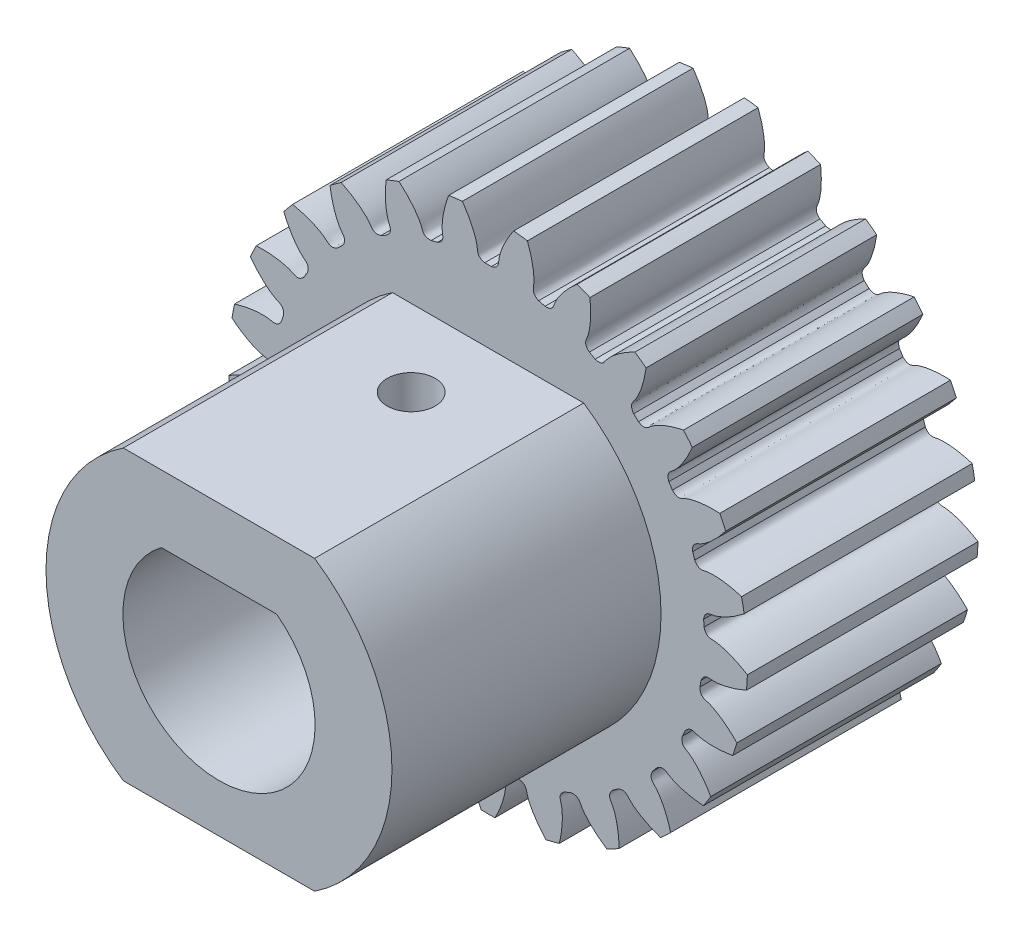
from build123d import *

# Parameters (mm, degrees)
SKETCH_1_R               = 13.5
EXTRUDE_1_DEPTH          = 12
CUT_EXTRUDE_1_DEPTH      = 23.549944568
PATTERN_CIRCULAR_1_COUNT = 25
CUT_EXTRUDE_2_DEPTH      = 23.544647042
CUT_EXTRUDE_2_DEPTH_BACK = 23.544647042
EXTRUDE_2_DEPTH          = 14
CUT_EXTRUDE_3_DEPTH      = 37.0417967
CUT_EXTRUDE_3_DEPTH_BACK = 37.0417967
SKETCH_6_R               = 1.25
EXTRUDE_3_DEPTH          = 5.8
CUT_EXTRUDE_4_DEPTH      = 33.253079125
CUT_EXTRUDE_4_DEPTH_BACK = 33.253079125
SKETCH_8_R               = 2.2
SKETCH_9_R               = 4.5
CUT_EXTRUDE_5_DEPTH      = 4


with BuildPart() as part:
    # 草图1 → 凸台-拉伸1 (new body)
    with BuildSketch(Plane.XY):
        Circle(SKETCH_1_R)
    extrude(amount=EXTRUDE_1_DEPTH)

    # 草图2 → 切除-拉伸1 (cut, through all)
    with BuildSketch(Plane.XY):
        with BuildLine():
            ThreePointArc((0.172058488, 11.248684184), (0, 11.25), (-0.172058488, 11.248684184))
            add(Edge.make_bspline(
                [(-0.172058488, 11.248684184), (-0.573339813, 11.335081162), (-0.535507636, 11.577261395), (-0.574195385, 11.818052755), (-0.579621271, 11.848108442), (-0.586576431, 11.882655524), (-0.595235519, 11.92164445), (-0.605780785, 11.965018581), (-0.618389929, 12.012716397), (-0.633239846, 12.064670833), (-0.650505245, 12.12080955), (-0.670358893, 12.181054916), (-0.692971355, 12.245324079), (-0.718510893, 12.313529018), (-0.747143311, 12.385576605), (-0.779031826, 12.461368667), (-0.814336931, 12.540802054), (-0.853216262, 12.623768711), (-0.895824463, 12.710155749), (-0.942313061, 12.799845522), (-0.992830335, 12.89271571), (-1.047521189, 12.988639399), (-1.106527031, 13.087485173), (-1.16998565, 13.189117198), (-1.238031093, 13.293395316), (-1.310793554, 13.400175144), (-1.388399253, 13.509308172), (-1.470970327, 13.62064186), (-1.558624719, 13.73401975), (-1.651476069, 13.849281567), (-1.749633611, 13.966263332), (-1.85320207, 14.084797476), (-1.962281562, 14.204712951), (-2.076967498, 14.325835353), (-2.19735049, 14.447987038), (-2.323516261, 14.570987249), (-2.455545555, 14.694652236), (-2.593514059, 14.818795387), (-2.737492286, 14.943227359), (-2.939973945, 15.111266274), (-3.09746655, 15.234093153), (-3.205271476, 15.314834171)],
                knots=[0, 0, 0, 0, 0.130741207, 0.13574479, 0.141658115, 0.148481183, 0.156213993, 0.164856545, 0.174408839, 0.184870876, 0.196242655, 0.208524177, 0.221715441, 0.235816447, 0.250827195, 0.266747686, 0.283577919, 0.301317894, 0.319967612, 0.339527072, 0.359996274, 0.381375219, 0.403663906, 0.426862335, 0.450970507, 0.475988421, 0.501916077, 0.528753476, 0.556500617, 0.5851575, 0.614724126, 0.645200493, 0.676586604, 0.708882456, 0.742088051, 0.776203388, 0.811228468, 0.847163289, 0.884007854, 0.92176216, 1, 1, 1, 1], degree=3))
            ThreePointArc((-3.205271476, 15.314834171), (0, 15.646658139), (3.205271476, 15.314834171))
            add(Edge.make_bspline(
                [(0.172058488, 11.248684184), (0.573339813, 11.335081162), (0.535507636, 11.577261395), (0.574195385, 11.818052755), (0.579621271, 11.848108442), (0.586576431, 11.882655524), (0.595235519, 11.92164445), (0.605780785, 11.965018581), (0.618389929, 12.012716397), (0.633239846, 12.064670833), (0.650505245, 12.12080955), (0.670358893, 12.181054916), (0.692971355, 12.245324079), (0.718510893, 12.313529018), (0.747143311, 12.385576605), (0.779031826, 12.461368667), (0.814336931, 12.540802054), (0.853216262, 12.623768711), (0.895824463, 12.710155749), (0.942313061, 12.799845522), (0.992830335, 12.89271571), (1.047521189, 12.988639399), (1.106527031, 13.087485173), (1.16998565, 13.189117198), (1.238031093, 13.293395316), (1.310793554, 13.400175144), (1.388399253, 13.509308172), (1.470970327, 13.62064186), (1.558624719, 13.73401975), (1.651476069, 13.849281567), (1.749633611, 13.966263332), (1.85320207, 14.084797476), (1.962281562, 14.204712951), (2.076967498, 14.325835353), (2.19735049, 14.447987038), (2.323516261, 14.570987249), (2.455545555, 14.694652236), (2.593514059, 14.818795387), (2.737492286, 14.943227359), (2.939973945, 15.111266274), (3.09746655, 15.234093153), (3.205271476, 15.314834171)],
                knots=[0, 0, 0, 0, 0.130741207, 0.13574479, 0.141658115, 0.148481183, 0.156213993, 0.164856545, 0.174408839, 0.184870876, 0.196242655, 0.208524177, 0.221715441, 0.235816447, 0.250827195, 0.266747686, 0.283577919, 0.301317894, 0.319967612, 0.339527072, 0.359996274, 0.381375219, 0.403663906, 0.426862335, 0.450970507, 0.475988421, 0.501916077, 0.528753476, 0.556500617, 0.5851575, 0.614724126, 0.645200493, 0.676586604, 0.708882456, 0.742088051, 0.776203388, 0.811228468, 0.847163289, 0.884007854, 0.92176216, 1, 1, 1, 1], degree=3))
        make_face()
    cut_extrude_1 = extrude(amount=CUT_EXTRUDE_1_DEPTH, mode=Mode.SUBTRACT)

    # 阵列(圆周)1: 切除-拉伸1 ×25 about axis
    pattern_circular_1_axis = Axis((0, 0, 12), (0, 0, -1))
    for i in range(1, PATTERN_CIRCULAR_1_COUNT):
        add(cut_extrude_1.rotate(pattern_circular_1_axis, i * 360 / PATTERN_CIRCULAR_1_COUNT), mode=Mode.SUBTRACT)

    # 草图4 → 切除-拉伸2 (cut, two sides: drawn at the far end of the back side and taken through both)
    with BuildSketch(Plane.XY.offset(12).offset(-CUT_EXTRUDE_2_DEPTH_BACK)):
        with BuildLine():
            Line((3, 4), (-3, 4))
            ThreePointArc((-3, 4), (0, -5), (3, 4))
        make_face()
    extrude(amount=CUT_EXTRUDE_2_DEPTH + CUT_EXTRUDE_2_DEPTH_BACK, mode=Mode.SUBTRACT)

    # 草图5 → 凸台-拉伸2 (add)
    with BuildSketch(Plane.XY.offset(12)):
        with BuildLine():
            Line((-4.974937186, 7.5), (4.974937186, 7.5))
            ThreePointArc((4.974937186, 7.5), (9, 0), (4.974937186, -7.5))
            Line((4.974937186, -7.5), (-4.974937186, -7.5))
            ThreePointArc((-4.974937186, -7.5), (-9, 0), (-4.974937186, 7.5))
        make_face()
        with BuildLine():
            Line((3, 4), (-3, 4))
            ThreePointArc((-3, 4), (0, -5), (3, 4))
        make_face(mode=Mode.SUBTRACT)
    extrude(amount=EXTRUDE_2_DEPTH)

    # 草图6 → 切除-拉伸3 (cut, two sides: drawn at the far end of the back side and taken through both)
    with BuildSketch(Plane(origin=(0, 7.5, 0), x_dir=(1, 0, 0), z_dir=(0, 1, 0)).offset(-CUT_EXTRUDE_3_DEPTH_BACK)):
        with Locations((0, -16)):
            Circle(SKETCH_6_R)
    extrude(amount=CUT_EXTRUDE_3_DEPTH + CUT_EXTRUDE_3_DEPTH_BACK, mode=Mode.SUBTRACT)

    # 草图7 → 凸台-拉伸3 (add)
    with BuildSketch(Plane(origin=(0, 0, 0), x_dir=(-1, 0, 0), z_dir=(0, 0, -1))):
        with BuildLine():
            Line((-3, 4), (3, 4))
            ThreePointArc((3, 4), (0, -5), (-3, 4))
        make_face()
    extrude(amount=-EXTRUDE_3_DEPTH)

    # 草图8 → 切除-拉伸4 (cut, two sides: drawn at the far end of the back side and taken through both)
    with BuildSketch(Plane(origin=(0, 0, 0), x_dir=(-1, 0, 0), z_dir=(0, 0, -1)).offset(-CUT_EXTRUDE_4_DEPTH_BACK)):
        Circle(SKETCH_8_R)
    extrude(amount=CUT_EXTRUDE_4_DEPTH + CUT_EXTRUDE_4_DEPTH_BACK, mode=Mode.SUBTRACT)

    # 草图9 → 切除-拉伸5 (cut)
    with BuildSketch(Plane(origin=(0, 0, 0), x_dir=(-1, 0, 0), z_dir=(0, 0, -1))):
        Circle(SKETCH_9_R)
    extrude(amount=-CUT_EXTRUDE_5_DEPTH, mode=Mode.SUBTRACT)


solid = part.part
